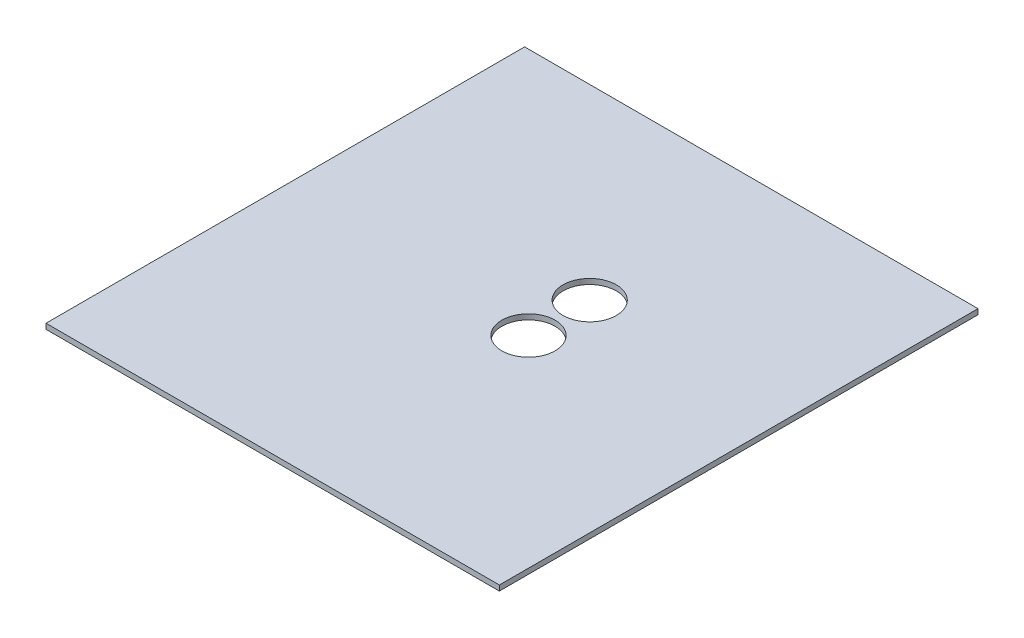
from build123d import *

# Parameters (mm, degrees)
SKETCH1_W          = 170.311348289
SKETCH1_H          = 179.801248385
BASE_FLANGE1_DEPTH = 2
SKETCH2_R          = 10
CUT_EXTRUDE1_DEPTH = 10


# Sheet-metal steps are written as plain solids
with BuildPart() as part:
    # Sketch1 → Base-Flange1 (new body)
    with BuildSketch(Plane(origin=(0, 0, 0), x_dir=(1, 0, 0), z_dir=(0, 1, 0))):
        with Locations((40.529390711, -63.628699267)):
            Rectangle(SKETCH1_W, SKETCH1_H)
    extrude(amount=-BASE_FLANGE1_DEPTH)

    # Sketch2 → Cut-Extrude1 (cut)
    with BuildSketch(Plane(origin=(0, 0, 0), x_dir=(1, 0, 0), z_dir=(0, 1, 0))):
        with Locations(Location((49.986549923, -43.89580223, 0), (0, 0, 270))):
            Circle(SKETCH2_R)
        with Locations(Location((49.986549923, -66.89580223, 0), (0, 0, 270))):
            Circle(SKETCH2_R)
    extrude(amount=-CUT_EXTRUDE1_DEPTH, mode=Mode.SUBTRACT)


solid = part.part
